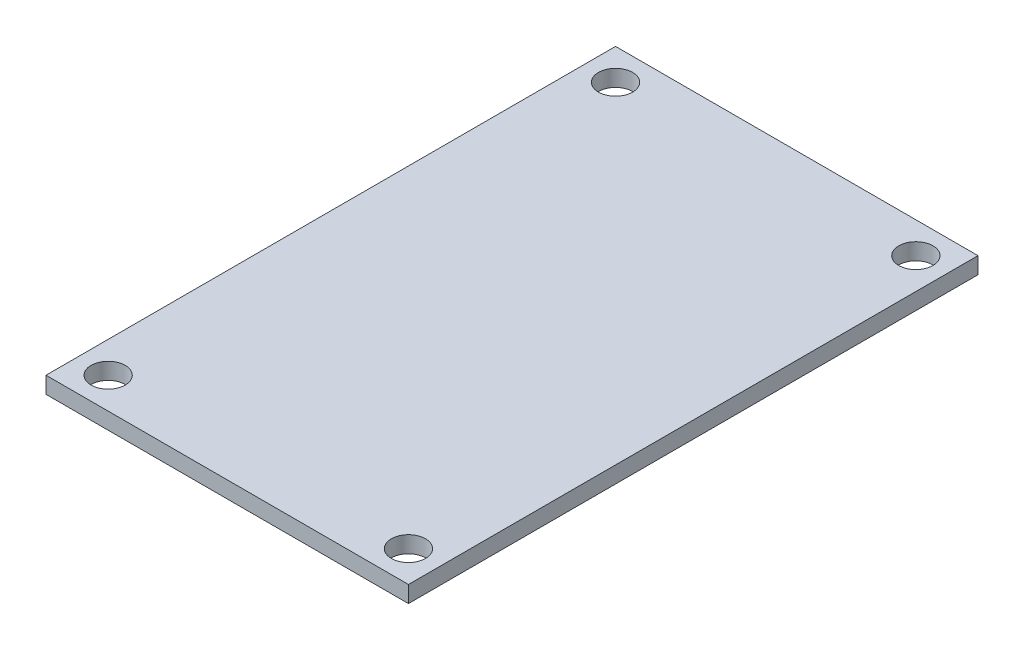
from build123d import *

# Parameters (mm, degrees)
SKETCH1_W           = 35
SKETCH1_H           = 55
SKETCH1_R           = 1.65
BOSS_EXTRUDE1_DEPTH = 1.6


with BuildPart() as part:
    # Sketch1 → Boss-Extrude1 (new body)
    with BuildSketch(Plane(origin=(0, 0, 0), x_dir=(1, 0, 0), z_dir=(0, 1, 0))):
        with Locations((17.5, 27.5)):
            Rectangle(SKETCH1_W, SKETCH1_H)
        with Locations((3, 3)):
            Circle(SKETCH1_R, mode=Mode.SUBTRACT)
        with Locations((32, 3)):
            Circle(SKETCH1_R, mode=Mode.SUBTRACT)
        with Locations((3, 52)):
            Circle(SKETCH1_R, mode=Mode.SUBTRACT)
        with Locations((32, 52)):
            Circle(SKETCH1_R, mode=Mode.SUBTRACT)
    extrude(amount=BOSS_EXTRUDE1_DEPTH)


solid = part.part
